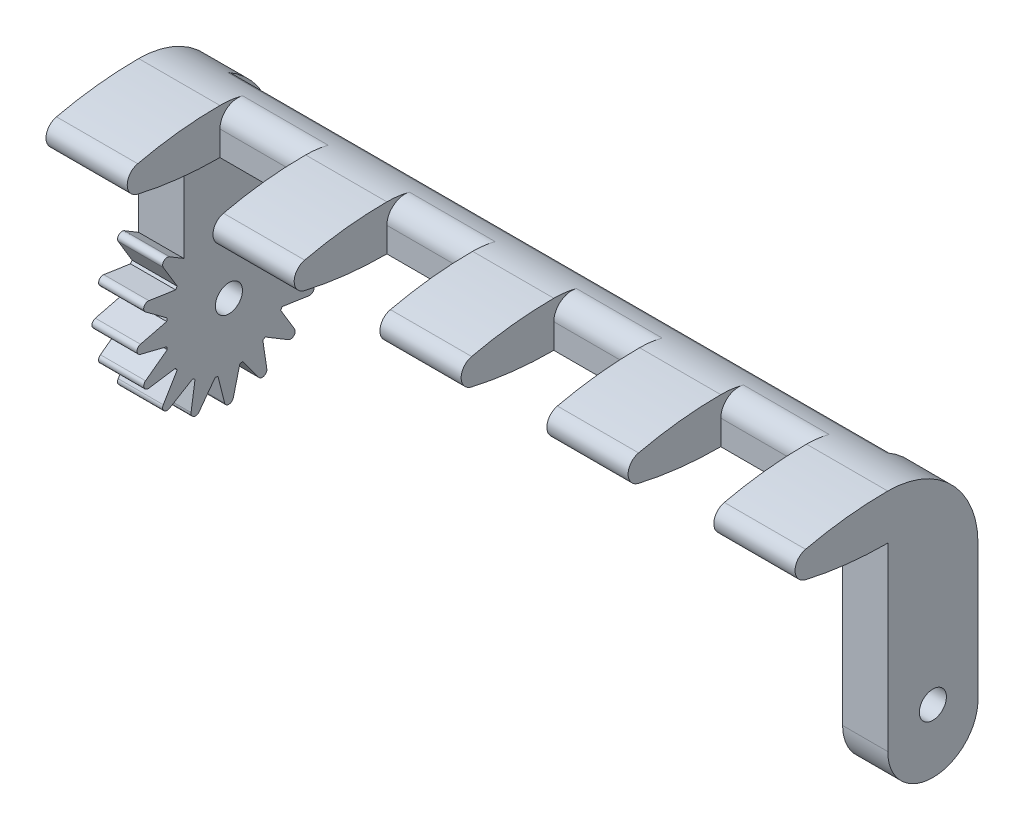
from build123d import *

# Parameters (mm, degrees)
BOSS_EXTRU_1_DEPTH               = 10
BOSS_EXTRU_2_DEPTH               = 9
CONG_1_R                         = 1.5
R_P_TITION_LIN_AIRE1_COUNT       = 5
R_P_TITION_LIN_AIRE1_PITCH       = 18.5
CONG_1_OF_R_P_TITION_LIN_AIRE1_R = 1.5
ENL_V_MAT_EXTRU_1_DEPTH          = 82.974649169
ENL_V_MAT_EXTRU_1_DEPTH_BACK     = 82.974649169
ESQUISSE4_R                      = 1.5
CONG_2_RADIUS                    = 5
CONG_2_LENGTH                    = 5
CONG_3_RADIUS                    = 5
CONG_3_LENGTH                    = 5
CONG_4_R                         = 10
ESQUISSE5_R                      = 1.5
BOSS_EXTRU_3_DEPTH               = 5
CONG_7_R                         = 2
CONG_8_R                         = 2


with BuildPart() as part:
    # Esquisse1 → Boss.-Extru.1 (new body)
    with BuildSketch(Plane.XY):
        Polygon((-36.5, 10), (36.5, 10), (36.5, -10), (36.5, -15), (41.5, -15), (41.5, 15), (-41.5, 15), (-41.5, -15), (-36.5, -15), (-36.5, -10), align=None)
    extrude(amount=BOSS_EXTRU_1_DEPTH)

    # Esquisse2 → Boss.-Extru.2 (add)
    with BuildSketch(Plane.ZY.offset(41.5)):
        with BuildLine():
            Line((10, 10), (10, 15))
            ThreePointArc((10, 15), (17.110731327, 14.370095429), (24, 12.5))
            ThreePointArc((24, 12.5), (17.110731327, 10.629904571), (10, 10))
        make_face()
    boss_extru_2 = extrude(amount=-BOSS_EXTRU_2_DEPTH)

    # Congé1
    cong_1_edges = [part.edges().sort_by_distance(p)[0] for p in [
        (-37, 12.5, 24),
    ]]
    fillet(cong_1_edges, radius=CONG_1_R)

    # Répétition linéaire1: Boss.-Extru.2 ×5
    with Locations(*[(i * R_P_TITION_LIN_AIRE1_PITCH, 0, 0) for i in range(1, R_P_TITION_LIN_AIRE1_COUNT)]):
        add(boss_extru_2)

    # Congé1 of Répétition linéaire1
    cong_1_of_r_p_tition_lin_aire1_edges = [part.edges().sort_by_distance(p)[0] for p in [
        (-18.5, 12.5, 24),
        (0, 12.5, 24),
        (18.5, 12.5, 24),
        (37, 12.5, 24),
    ]]
    fillet(cong_1_of_r_p_tition_lin_aire1_edges, radius=CONG_1_OF_R_P_TITION_LIN_AIRE1_R)

    # Esquisse4 → Enlèv. mat.-Extru.1 (cut, two sides: drawn at the far end of the back side and taken through both)
    with BuildSketch(Plane(origin=(-36.5, 0, 0), x_dir=(0, 0, -1), z_dir=(1, 0, 0)).offset(-ENL_V_MAT_EXTRU_1_DEPTH_BACK)):
        with Locations((-5, -8)):
            Circle(ESQUISSE4_R)
    extrude(amount=ENL_V_MAT_EXTRU_1_DEPTH + ENL_V_MAT_EXTRU_1_DEPTH_BACK, mode=Mode.SUBTRACT)

    # Congé2: full round fillet: the end face becomes a half cylinder, R = half its width
    cong_2_face = Plane((-39, -15, 5), x_dir=(1, 0, 0), z_dir=(0, -1, 0))  # on the end face: x along it, z out of the body
    cong_2_slab = cong_2_face.offset(-CONG_2_RADIUS / 2) * Box(CONG_2_LENGTH, 2 * CONG_2_RADIUS, CONG_2_RADIUS, mode=Mode.PRIVATE)  # the body's end, R deep
    cong_2_round = Plane((-39, -10, 5), x_dir=(0, -1, 0), z_dir=(1, 0, 0)) * Cylinder(CONG_2_RADIUS, CONG_2_LENGTH, mode=Mode.PRIVATE)  # its axis R under the face
    add(cong_2_slab - cong_2_round, mode=Mode.SUBTRACT)

    # Congé3: full round fillet: the end face becomes a half cylinder, R = half its width
    cong_3_face = Plane((39, -15, 5), x_dir=(1, 0, 0), z_dir=(0, -1, 0))  # on the end face: x along it, z out of the body
    cong_3_slab = cong_3_face.offset(-CONG_3_RADIUS / 2) * Box(CONG_3_LENGTH, 2 * CONG_3_RADIUS, CONG_3_RADIUS, mode=Mode.PRIVATE)  # the body's end, R deep
    cong_3_round = Plane((39, -10, 5), x_dir=(0, -1, 0), z_dir=(1, 0, 0)) * Cylinder(CONG_3_RADIUS, CONG_3_LENGTH, mode=Mode.PRIVATE)  # its axis R under the face
    add(cong_3_slab - cong_3_round, mode=Mode.SUBTRACT)

    # Congé4
    # the kernel refuses this fillet: 10 mm, written as the material it takes off along each edge
    with BuildSketch(Plane(origin=(66.5, 15, 0), x_dir=(0, -1, 0), z_dir=(-1, 0, 0))) as cong_4_piece_1:
        with BuildLine():
            CenterArc((CONG_4_R, CONG_4_R), CONG_4_R, 180, 90)
            Line((0, CONG_4_R), (0, 0))
            Line((0, 0), (CONG_4_R, 0))
        make_face()
    extrude(amount=133, mode=Mode.SUBTRACT)

    # Esquisse5 → Boss.-Extru.3 (add, through all)
    with BuildSketch(Plane(origin=(-36.5, 0, 0), x_dir=(0, 0, -1), z_dir=(1, 0, 0))):
        with BuildLine():
            Line((-14.800353701, -8.485147863), (-11.894696869, -9.209609478))
            ThreePointArc((-11.894696869, -9.209609478), (-11.865496963, -9.365632254), (-11.832766827, -9.520952824))
            Line((-11.832766827, -9.520952824), (-14.240004245, -11.302214812))
            ThreePointArc((-14.240004245, -11.302214812), (-14.404532618, -11.895484958), (-13.868688146, -12.198651174))
            Line((-13.868688146, -12.198651174), (-10.906971813, -11.756019702))
            ThreePointArc((-10.906971813, -11.756019702), (-10.820287286, -11.888991631), (-10.730609975, -12.019963846))
            Line((-10.730609975, -12.019963846), (-12.272947904, -14.586845216))
            ThreePointArc((-12.272947904, -14.586845216), (-12.197917644, -15.197917644), (-11.586845216, -15.272947904))
            Line((-11.586845216, -15.272947904), (-9.019963846, -13.730609975))
            ThreePointArc((-9.019963846, -13.730609975), (-8.888991631, -13.820287286), (-8.756019702, -13.906971813))
            Line((-8.756019702, -13.906971813), (-9.198651174, -16.868688146))
            ThreePointArc((-9.198651174, -16.868688146), (-8.895484958, -17.404532618), (-8.302214812, -17.240004245))
            Line((-8.302214812, -17.240004245), (-6.520952824, -14.832766827))
            ThreePointArc((-6.520952824, -14.832766827), (-6.365632254, -14.865496963), (-6.209609478, -14.894696869))
            Line((-6.209609478, -14.894696869), (-5.485147863, -17.800353701))
            ThreePointArc((-5.485147863, -17.800353701), (-5, -18.179392753), (-4.514852137, -17.800353701))
            Line((-4.514852137, -17.800353701), (-3.790390522, -14.894696869))
            ThreePointArc((-3.790390522, -14.894696869), (-3.634367746, -14.865496963), (-3.479047176, -14.832766827))
            Line((-3.479047176, -14.832766827), (-1.697785188, -17.240004245))
            ThreePointArc((-1.697785188, -17.240004245), (-1.104515042, -17.404532618), (-0.801348826, -16.868688146))
            Line((-0.801348826, -16.868688146), (-1.243980298, -13.906971813))
            ThreePointArc((-1.243980298, -13.906971813), (-1.111008369, -13.820287286), (-0.980036154, -13.730609975))
            Line((-0.980036154, -13.730609975), (1.586845216, -15.272947904))
            ThreePointArc((1.586845216, -15.272947904), (2.197917644, -15.197917644), (2.272947904, -14.586845216))
            Line((2.272947904, -14.586845216), (0.730609975, -12.019963846))
            ThreePointArc((0.730609975, -12.019963846), (0.820287286, -11.888991631), (0.906971813, -11.756019702))
            Line((0.906971813, -11.756019702), (3.868688146, -12.198651174))
            ThreePointArc((3.868688146, -12.198651174), (4.404532618, -11.895484958), (4.240004245, -11.302214812))
            Line((4.240004245, -11.302214812), (1.832766827, -9.520952824))
            ThreePointArc((1.832766827, -9.520952824), (1.865496963, -9.365632254), (1.894696869, -9.209609478))
            Line((1.894696869, -9.209609478), (4.800353701, -8.485147863))
            ThreePointArc((4.800353701, -8.485147863), (5.179392753, -8), (4.800353701, -7.514852137))
            Line((4.800353701, -7.514852137), (1.894696869, -6.790390522))
            ThreePointArc((1.894696869, -6.790390522), (1.865496963, -6.634367746), (1.832766827, -6.479047176))
            Line((1.832766827, -6.479047176), (4.240004245, -4.697785188))
            ThreePointArc((4.240004245, -4.697785188), (4.404532618, -4.104515042), (3.868688146, -3.801348826))
            Line((3.868688146, -3.801348826), (0.906971813, -4.243980298))
            ThreePointArc((0.906971813, -4.243980298), (0.820287286, -4.111008369), (0.730609975, -3.980036154))
            Line((0.730609975, -3.980036154), (2.272947904, -1.413154784))
            ThreePointArc((2.272947904, -1.413154784), (2.197917644, -0.802082356), (1.586845216, -0.727052096))
            Line((1.586845216, -0.727052096), (-0.980036154, -2.269390025))
            ThreePointArc((-0.980036154, -2.269390025), (-1.111008369, -2.179712714), (-1.243980298, -2.093028187))
            Line((-1.243980298, -2.093028187), (-0.801348826, 0.868688146))
            ThreePointArc((-0.801348826, 0.868688146), (-1.104515042, 1.404532618), (-1.697785188, 1.240004245))
            Line((-1.697785188, 1.240004245), (-3.479047176, -1.167233173))
            ThreePointArc((-3.479047176, -1.167233173), (-3.634367746, -1.134503037), (-3.790390522, -1.105303131))
            Line((-3.790390522, -1.105303131), (-4.514852137, 1.800353701))
            ThreePointArc((-4.514852137, 1.800353701), (-5, 2.179392753), (-5.485147863, 1.800353701))
            Line((-5.485147863, 1.800353701), (-6.209609478, -1.105303131))
            ThreePointArc((-6.209609478, -1.105303131), (-6.365632254, -1.134503037), (-6.520952824, -1.167233173))
            Line((-6.520952824, -1.167233173), (-8.302214812, 1.240004245))
            ThreePointArc((-8.302214812, 1.240004245), (-8.895484958, 1.404532618), (-9.198651174, 0.868688146))
            Line((-9.198651174, 0.868688146), (-8.756019702, -2.093028187))
            ThreePointArc((-8.756019702, -2.093028187), (-8.888991631, -2.179712714), (-9.019963846, -2.269390025))
            Line((-9.019963846, -2.269390025), (-11.586845216, -0.727052096))
            ThreePointArc((-11.586845216, -0.727052096), (-12.197917644, -0.802082356), (-12.272947904, -1.413154784))
            Line((-12.272947904, -1.413154784), (-10.730609975, -3.980036154))
            ThreePointArc((-10.730609975, -3.980036154), (-10.820287286, -4.111008369), (-10.906971813, -4.243980298))
            Line((-10.906971813, -4.243980298), (-13.868688146, -3.801348826))
            ThreePointArc((-13.868688146, -3.801348826), (-14.404532618, -4.104515042), (-14.240004245, -4.697785188))
            Line((-14.240004245, -4.697785188), (-11.832766827, -6.479047176))
            ThreePointArc((-11.832766827, -6.479047176), (-11.865496963, -6.634367746), (-11.894696869, -6.790390522))
            Line((-11.894696869, -6.790390522), (-14.800353701, -7.514852137))
            ThreePointArc((-14.800353701, -7.514852137), (-15.179392753, -8), (-14.800353701, -8.485147863))
        make_face()
        with Locations((-5, -8)):
            Circle(ESQUISSE5_R, mode=Mode.SUBTRACT)
    extrude(amount=-BOSS_EXTRU_3_DEPTH)

    # Congé7
    cong_7_edges = [part.edges().sort_by_distance(p)[0] for p in [
        (0, 10, 1.339745962),
    ]]
    fillet(cong_7_edges, radius=CONG_7_R)

    # Congé8
    cong_8_edges = [part.edges().sort_by_distance(p)[0] for p in [
        (-27.75, 15, 10),
        (-9.25, 15, 10),
        (9.25, 15, 10),
        (27.75, 15, 10),
    ]]
    fillet(cong_8_edges, radius=CONG_8_R)


solid = part.part
